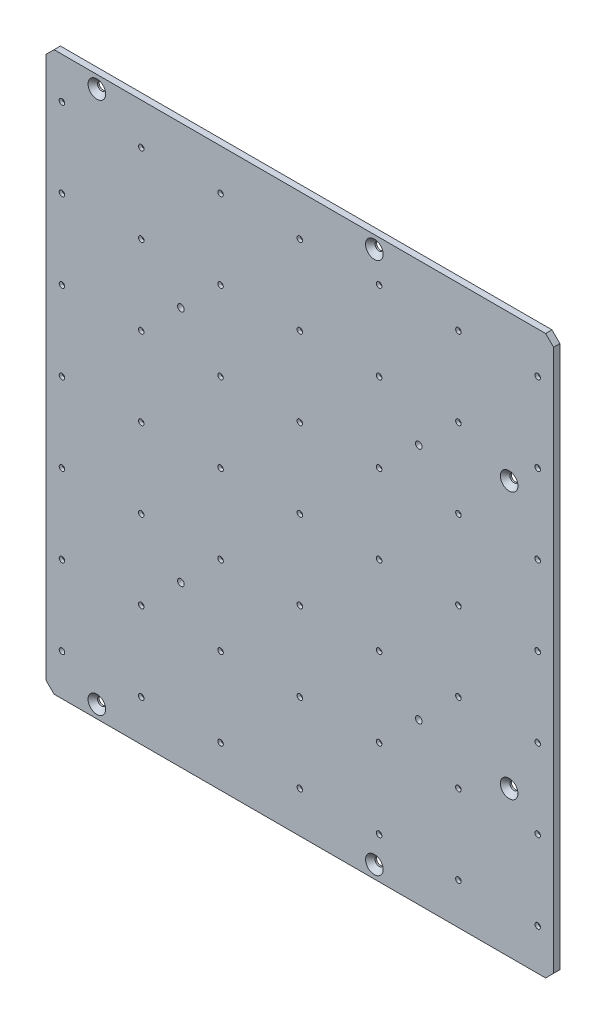
from build123d import *

# Parameters (mm, degrees)
BASE_DEPTH             = 4
SKETCH2_R              = 2.55
MOUNTHOLES_DEPTH       = 8
CHAMFERFORMOUNT_SIZE   = 3
SKETCH5_R              = 1.75
AIRHOLDHOLES_DEPTH     = 238.890731219
SKETCH6_R              = 2.1
SCREWHOLDHOLES_DEPTH   = 238.890731219
SKETCH7_R              = 4
BLINDFITTINGHOLE_DEPTH = 2
CUT_EXTRUDE6_DEPTH     = 2


with BuildPart() as part:
    # Sketch1 → Base (new body)
    with BuildSketch(Plane.XY):
        Polygon((-155, 176), (-160, 171), (-160, -171), (-155, -176), (155, -176), (160, -171), (160, 171), (155, 176), align=None)
    extrude(amount=BASE_DEPTH)

    # Sketch2 → MountHoles (cut)
    with BuildSketch(Plane.XY.offset(4)):
        with Locations((-128, 168)):
            Circle(SKETCH2_R)
        with Locations((47, 168)):
            Circle(SKETCH2_R)
        with Locations((132, 84)):
            Circle(SKETCH2_R)
        with Locations((132, -84)):
            Circle(SKETCH2_R)
        with Locations((47, -168)):
            Circle(SKETCH2_R)
        with Locations((-128, -168)):
            Circle(SKETCH2_R)
    extrude(amount=-MOUNTHOLES_DEPTH, mode=Mode.SUBTRACT)

    # ChamferForMount
    chamferformount_edges = [part.edges().sort_by_distance(p)[0] for p in [
        (-130.55, 168, 4),
        (44.45, 168, 4),
        (129.45, 84, 4),
        (129.45, -84, 4),
        (44.45, -168, 4),
        (-130.55, -168, 4),
    ]]
    chamfer(chamferformount_edges, length=CHAMFERFORMOUNT_SIZE)

    # Sketch5 → AirHoldHoles (cut, through all)
    with BuildSketch(Plane.XY.offset(4)):
        with Locations((50, 0)):
            Circle(SKETCH5_R)
        with Locations((100, 0)):
            Circle(SKETCH5_R)
        with Locations((150, 0)):
            Circle(SKETCH5_R)
        with Locations((50, 50)):
            Circle(SKETCH5_R)
        with Locations((100, 50)):
            Circle(SKETCH5_R)
        with Locations((150, 50)):
            Circle(SKETCH5_R)
        with Locations((50, 100)):
            Circle(SKETCH5_R)
        with Locations((100, 100)):
            Circle(SKETCH5_R)
        with Locations((150, 100)):
            Circle(SKETCH5_R)
        with Locations((50, 150)):
            Circle(SKETCH5_R)
        Circle(SKETCH5_R)
        with Locations((100, 150)):
            Circle(SKETCH5_R)
        with Locations((150, 150)):
            Circle(SKETCH5_R)
        with Locations((0, 50)):
            Circle(SKETCH5_R)
        with Locations((0, 100)):
            Circle(SKETCH5_R)
        with Locations((0, 150)):
            Circle(SKETCH5_R)
        with Locations((0, -150)):
            Circle(SKETCH5_R)
        with Locations((0, -100)):
            Circle(SKETCH5_R)
        with Locations((0, -50)):
            Circle(SKETCH5_R)
        with Locations((150, -150)):
            Circle(SKETCH5_R)
        with Locations((100, -150)):
            Circle(SKETCH5_R)
        with Locations((50, -150)):
            Circle(SKETCH5_R)
        with Locations((150, -100)):
            Circle(SKETCH5_R)
        with Locations((100, -100)):
            Circle(SKETCH5_R)
        with Locations((50, -100)):
            Circle(SKETCH5_R)
        with Locations((150, -50)):
            Circle(SKETCH5_R)
        with Locations((100, -50)):
            Circle(SKETCH5_R)
        with Locations((50, -50)):
            Circle(SKETCH5_R)
        with Locations((-150, 0)):
            Circle(SKETCH5_R)
        with Locations((-100, 0)):
            Circle(SKETCH5_R)
        with Locations((-50, 0)):
            Circle(SKETCH5_R)
        with Locations((-50, -50)):
            Circle(SKETCH5_R)
        with Locations((-100, -50)):
            Circle(SKETCH5_R)
        with Locations((-150, -50)):
            Circle(SKETCH5_R)
        with Locations((-50, -100)):
            Circle(SKETCH5_R)
        with Locations((-100, -100)):
            Circle(SKETCH5_R)
        with Locations((-150, -100)):
            Circle(SKETCH5_R)
        with Locations((-50, -150)):
            Circle(SKETCH5_R)
        with Locations((-100, -150)):
            Circle(SKETCH5_R)
        with Locations((-150, -150)):
            Circle(SKETCH5_R)
        with Locations((-150, 150)):
            Circle(SKETCH5_R)
        with Locations((-100, 150)):
            Circle(SKETCH5_R)
        with Locations((-50, 150)):
            Circle(SKETCH5_R)
        with Locations((-150, 100)):
            Circle(SKETCH5_R)
        with Locations((-100, 100)):
            Circle(SKETCH5_R)
        with Locations((-50, 100)):
            Circle(SKETCH5_R)
        with Locations((-150, 50)):
            Circle(SKETCH5_R)
        with Locations((-100, 50)):
            Circle(SKETCH5_R)
        with Locations((-50, 50)):
            Circle(SKETCH5_R)
    extrude(amount=-AIRHOLDHOLES_DEPTH, mode=Mode.SUBTRACT)

    # Sketch6 → ScrewHoldHoles (cut, through all)
    with BuildSketch(Plane.XY.offset(4)):
        with Locations((-75, -75)):
            Circle(SKETCH6_R)
        with Locations((75, -75)):
            Circle(SKETCH6_R)
        with Locations((75, 75)):
            Circle(SKETCH6_R)
        with Locations((-75, 75)):
            Circle(SKETCH6_R)
    extrude(amount=-SCREWHOLDHOLES_DEPTH, mode=Mode.SUBTRACT)

    # Sketch7 → BlindFittingHole (cut)
    with BuildSketch(Plane(origin=(0, 0, 0), x_dir=(-1, 0, 0), z_dir=(0, 0, -1))):
        with Locations((130, 0)):
            Circle(SKETCH7_R)
    extrude(amount=-BLINDFITTINGHOLE_DEPTH, mode=Mode.SUBTRACT)

    # Sketch8 → Cut-Extrude6 (cut)
    with BuildSketch(Plane(origin=(0, 0, 0), x_dir=(-1, 0, 0), z_dir=(0, 0, -1))):
        Polygon((-150, 151.75), (-150, 148.25), (98.25, 148.25), (98.25, 101.75), (-150, 101.75), (-150, 98.25), (98.25, 98.25), (98.25, 51.75), (-150, 51.75), (-150, 48.25), (98.25, 48.25), (98.25, 1.75), (-150, 1.75), (-150, -1.75), (98.25, -1.75), (98.25, -48.25), (-150, -48.25), (-150, -51.75), (98.25, -51.75), (98.25, -98.25), (-150, -98.25), (-150, -101.75), (98.25, -101.75), (98.25, -148.25), (-150, -148.25), (-150, -151.75), (101.75, -151.75), (101.75, -50.484721939), (130.990833163, -1.75), (148.25, -1.75), (148.25, -150), (151.75, -150), (151.75, 150), (148.25, 150), (148.25, 1.75), (130.990833163, 1.75), (101.75, 50.484721939), (101.75, 151.75), align=None)
        Polygon((101.75, 43.681944728), (126.909166837, 1.75), (101.75, 1.75), align=None, mode=Mode.SUBTRACT)
        Polygon((126.909166837, -1.75), (101.75, -43.681944728), (101.75, -1.75), align=None, mode=Mode.SUBTRACT)
    extrude(amount=-CUT_EXTRUDE6_DEPTH, mode=Mode.SUBTRACT)


solid = part.part
